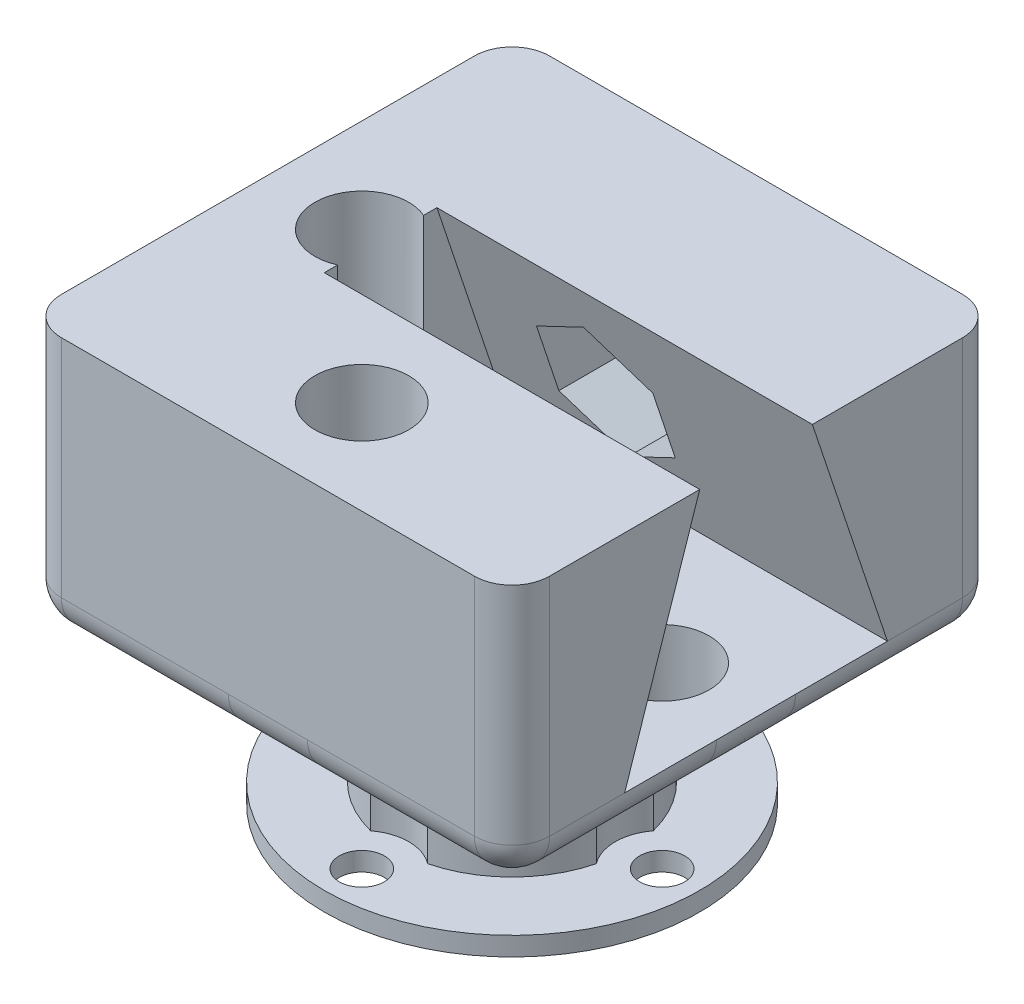
from build123d import *

# Parameters (mm, degrees)
M2_CLEARANCE_HOLE1_D            = 2.4
SKETCH5_W                       = 26
SKETCH5_H                       = 26
BOSS_EXTRUDE1_DEPTH             = 14
CUT_EXTRUDE1_DEPTH              = 20
M3_CLEARANCE_HOLE1_REACH        = 38.759
M3_CLEARANCE_HOLE1_BORE_R       = 1.8
CUT_EXTRUDE2_REACH              = 41.759
CUT_EXTRUDE2_START              = -3
FILLET1_R                       = 5
CUT_EXTRUDE3_START              = -1
SKETCH10_R                      = 2.5
CUT_EXTRUDE3_DEPTH              = 29.055980452
CIRPATTERN1_COUNT               = 2
CIRPATTERN1_ANGLE               = 90
CIRPATTERN1_THE_OTHER_WAY_COUNT = 2
CIRPATTERN1_THE_OTHER_WAY_ANGLE = 90
FILLET2_R                       = 2


with BuildPart() as part:
    # Sketch1 → Revolve1 (revolve)
    with BuildSketch(Plane.XY, mode=Mode.PRIVATE) as revolve1_sk:
        Polygon((0, 0), (10, 0), (10, 1), (6.2, 1), (6.2, 8.5), (0, 8.5), align=None)
    revolve(revolve1_sk.sketch.rotate(Axis((0, 33.075, 0), (0, -1, 0)), 90), axis=Axis((0, 33.075, 0), (0, -1, 0)))

    # M2 Clearance Hole1 (through all)
    with Locations(Plane(origin=(0, 1, 0), x_dir=(1, 0, 0), z_dir=(0, 1, 0))):
        with Locations((-8, 0), (8, 0), (0, 8), (0, -8)):
            Hole(M2_CLEARANCE_HOLE1_D / 2)

    # Sketch5 → Boss-Extrude1 (add)
    with BuildSketch(Plane(origin=(0, 8.5, 0), x_dir=(1, 0, 0), z_dir=(0, 1, 0))):
        Rectangle(SKETCH5_W, SKETCH5_H)
    extrude(amount=BOSS_EXTRUDE1_DEPTH)

    # Sketch6 → Cut-Extrude1 (cut)
    with BuildSketch(Plane(origin=(13, 0, 0), x_dir=(0, 0, -1), z_dir=(1, 0, 0))):
        Polygon((3, 22.5), (-3, 22.5), (-7, 10.5), (7, 10.5), align=None)
    extrude(amount=-CUT_EXTRUDE1_DEPTH, mode=Mode.SUBTRACT)

    # M3 Clearance Hole1 bore → M3 Clearance Hole1 (cut, up to next)
    with BuildSketch(Plane(origin=(0, 0, -13), x_dir=(-1, 0, 0), z_dir=(0, 0, -1)), mode=Mode.PRIVATE) as m3_clearance_hole1_sk1:
        with Locations((0, 16.5)):
            Circle(M3_CLEARANCE_HOLE1_BORE_R)
    m3_clearance_hole1_tool1 = extrude(m3_clearance_hole1_sk1.sketch, amount=-M3_CLEARANCE_HOLE1_REACH, mode=Mode.PRIVATE) & part.part
    add(m3_clearance_hole1_tool1.solids().sort_by_distance((0, 16.5, -13))[0], mode=Mode.SUBTRACT)

    # Cut-Extrude2: up to this plane
    cut_extrude2_end = Plane(origin=(-7, 10.5, -7), z_dir=(0, 0.31622776601683816, -0.9486832980505138))
    # Sketch9 → Cut-Extrude2 (cut, up to the surface)
    with BuildSketch(Plane(origin=(0, 0, -13), x_dir=(-1, 0, 0), z_dir=(0, 0, -1)).offset(CUT_EXTRUDE2_START), mode=Mode.PRIVATE) as cut_extrude2_sk1:
        Polygon((0, 12.920428331), (3.1, 14.710214166), (3.1, 18.289785834), (0, 20.079571669), (-3.1, 18.289785834), (-3.1, 14.710214166), align=None)
    cut_extrude2_tool1 = split(extrude(cut_extrude2_sk1.sketch, amount=-CUT_EXTRUDE2_REACH, mode=Mode.PRIVATE), bisect_by=cut_extrude2_end, keep=Keep.BOTH, mode=Mode.PRIVATE)
    add(cut_extrude2_tool1.solids().sort_by_distance((0, 16.5, -10))[0], mode=Mode.SUBTRACT)

    # Fillet1
    fillet1_edges = [part.edges().sort_by_distance(p)[0] for p in [
        (0, 8.5, -6.2),
    ]]
    fillet(fillet1_edges, radius=FILLET1_R)

    # Sketch10 → Cut-Extrude3 (cut, through all)
    with BuildSketch(Plane.XZ.offset(CUT_EXTRUDE3_START)):
        with Locations(Location((0, 8, 0), (0, 0, 270))):
            Circle(SKETCH10_R)
    cut_extrude3 = extrude(amount=-CUT_EXTRUDE3_DEPTH, mode=Mode.SUBTRACT)

    # CirPattern1: Cut-Extrude3 ×2 about axis
    cirpattern1_axis = Axis((0, 33.075, 0), (0, -1, 0))
    for i in range(1, CIRPATTERN1_COUNT):
        add(cut_extrude3.rotate(cirpattern1_axis, i * CIRPATTERN1_ANGLE / (CIRPATTERN1_COUNT - 1)), mode=Mode.SUBTRACT)

    # CirPattern1 the other way: Cut-Extrude3 ×2 about axis
    cirpattern1_the_other_way_axis = Axis((0, 33.075, 0), (0, 1, 0))
    for i in range(1, CIRPATTERN1_THE_OTHER_WAY_COUNT):
        add(cut_extrude3.rotate(cirpattern1_the_other_way_axis, i * CIRPATTERN1_THE_OTHER_WAY_ANGLE / (CIRPATTERN1_THE_OTHER_WAY_COUNT - 1)), mode=Mode.SUBTRACT)

    # Fillet2
    fillet2_edges = [part.edges().sort_by_distance(p)[0] for p in [
        (13, 8.5, 0),
        (13, 15.5, 13),
        (0, 8.5, -13),
        (13, 15.5, -13),
        (-13, 8.5, 0),
        (-13, 15.5, -13),
        (0, 8.5, 13),
        (-13, 15.5, 13),
    ]]
    fillet(fillet2_edges, radius=FILLET2_R - 0.0001)  # a hair under: the kernel refuses the full size


solid = part.part
